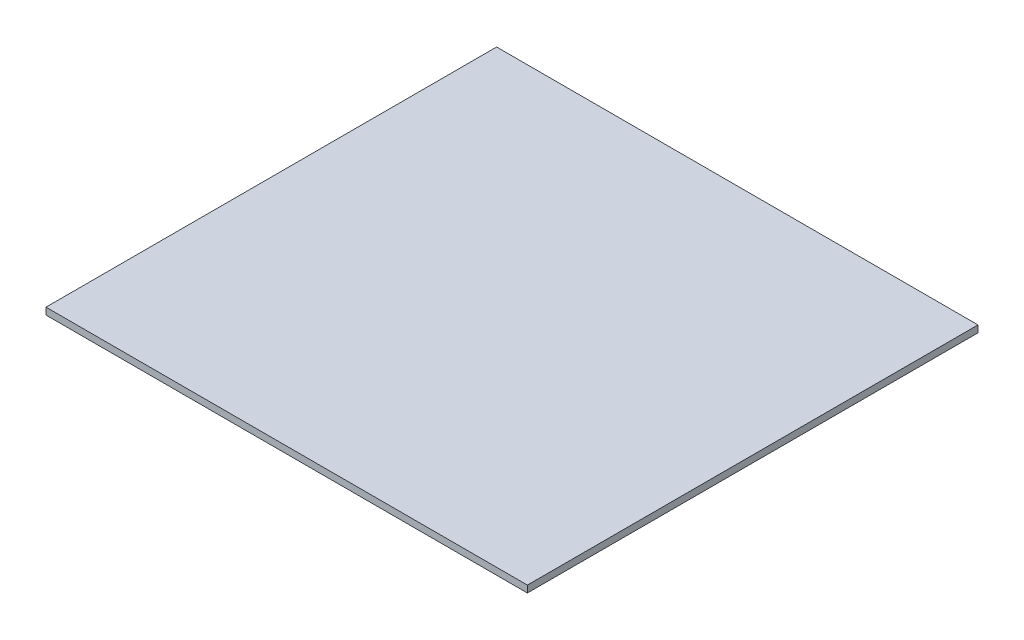
from build123d import *

# Parameters (mm, degrees)
BOSS_EXTRUDE1_DEPTH = 277.625
SKETCH3_W           = 700
SKETCH3_H           = 10
BOSS_EXTRUDE2_DEPTH = 50
SKETCH4_W           = 700
SKETCH4_H           = 10
BOSS_EXTRUDE3_DEPTH = 50


with BuildPart() as part:
    # Sketch2 → Boss-Extrude1 (new, symmetric)
    with BuildSketch(Plane.XY):
        Polygon((0, 40), (-350, 40), (-350, 30), (-225, 30), (-225, 0), (0, 0), align=None)
    boss_extrude1 = extrude(amount=BOSS_EXTRUDE1_DEPTH, both=True)

    # Mirror1: Boss-Extrude1 across plane
    add(boss_extrude1.mirror(Plane(origin=(0, 40, 277.625), x_dir=(0, 0, 1), z_dir=(-1, 0, 0))))

    # Sketch3 → Boss-Extrude2 (add)
    with BuildSketch(Plane.XY.offset(277.625)):
        with Locations((0, 35)):
            Rectangle(SKETCH3_W, SKETCH3_H)
    extrude(amount=BOSS_EXTRUDE2_DEPTH)

    # Sketch4 → Boss-Extrude3 (add)
    with BuildSketch(Plane(origin=(0, 0, -277.625), x_dir=(-1, 0, 0), z_dir=(0, 0, -1))):
        with Locations((0, 35)):
            Rectangle(SKETCH4_W, SKETCH4_H)
    extrude(amount=BOSS_EXTRUDE3_DEPTH)


solid = part.part
